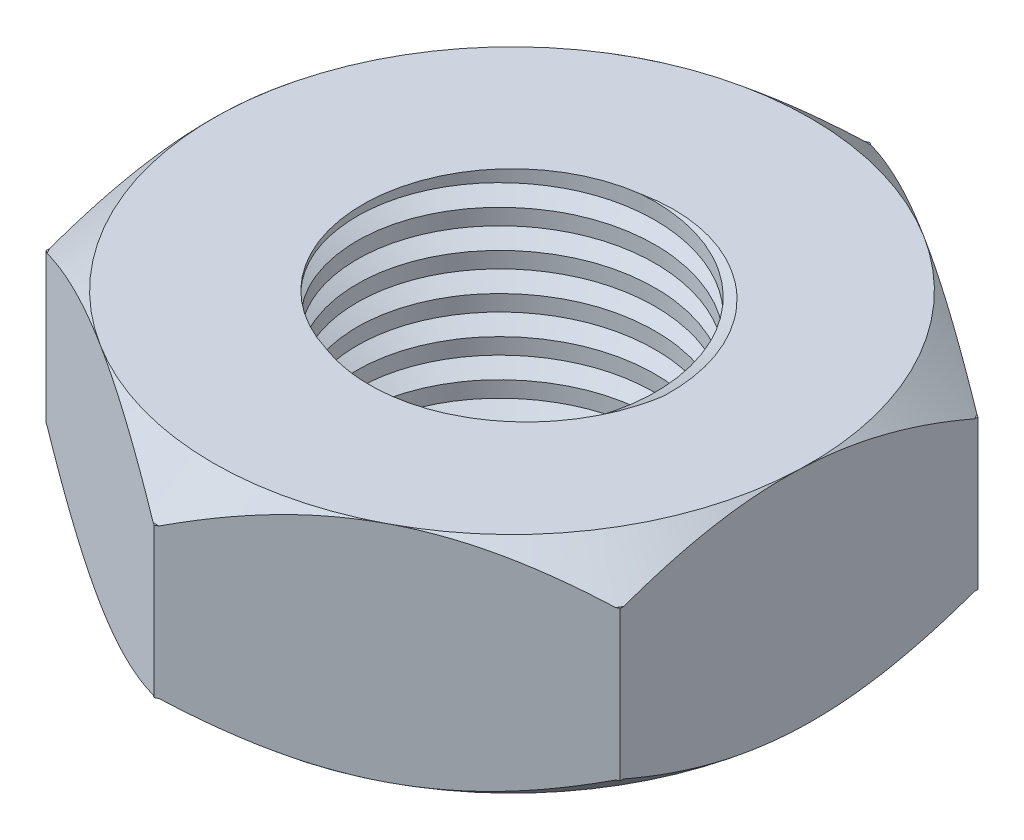
from build123d import *

# Parameters (mm, degrees)
SKETCH1_R           = 1
BOSS_EXTRUDE2_DEPTH = 1.5
SKETCH3_OUTSIDE_W   = 7.948
SKETCH3_OUTSIDE_H   = 8.48
SKETCH3_OUTSIDE_R   = 2
CUT_EXTRUDE2_DEPTH  = 0.25
CUT_EXTRUDE2_DRAFT  = -50
SKETCH4_OUTSIDE_W   = 7.948
SKETCH4_OUTSIDE_H   = 8.48
SKETCH4_OUTSIDE_R   = 2
CUT_EXTRUDE3_DEPTH  = 0.25
CUT_EXTRUDE3_DRAFT  = -50
CUT_SWEEP1_PITCH    = 0.25


with BuildPart() as part:
    # Sketch1 → Boss-Extrude2 (new body)
    with BuildSketch(Plane(origin=(0, 0, 0), x_dir=(1, 0, 0), z_dir=(0, 1, 0))):
        Polygon((2.042476162, 1.077786834), (0.087847303, 2.30772966), (-1.954628859, 1.229942826), (-2.042476162, -1.077786834), (-0.087847303, -2.30772966), (1.954628859, -1.229942826), align=None)
        with Locations(Location((0, 0, 0), (0, 0, 270))):
            Circle(SKETCH1_R, mode=Mode.SUBTRACT)
    extrude(amount=BOSS_EXTRUDE2_DEPTH)


with BuildPart() as cut_extrude2_tool:
    # Sketch3 outside → Cut-Extrude2 (with draft: the straight prism first)
    with BuildSketch(Plane(origin=(0, 1.5, 0), x_dir=(1, 0, 0), z_dir=(0, 1, 0))):
        Rectangle(SKETCH3_OUTSIDE_W, SKETCH3_OUTSIDE_H)
        Circle(SKETCH3_OUTSIDE_R, mode=Mode.SUBTRACT)
    extrude(amount=-CUT_EXTRUDE2_DEPTH)
    # Cut-Extrude2: the draft: its side faces are tilted about the plane it starts from
    cut_extrude2_sides = [cut_extrude2_tool.faces().sort_by_distance(p)[0] for p in [
        (0, 1.375, 4.24),
        (3.974, 1.375, 0),
        (0, 1.375, -4.24),
        (-3.974, 1.375, 0),
        (-2, 1.375, 0),
    ]]
    draft(cut_extrude2_sides, Plane(origin=(0, 1.5, 0), x_dir=(1, 0, 0), z_dir=(0, 1, 0)), CUT_EXTRUDE2_DRAFT)


with BuildPart() as part_1:
    add(part.part)

    # Cut-Extrude2: cut by cut_extrude2_tool
    add(cut_extrude2_tool.part, mode=Mode.SUBTRACT)


with BuildPart() as cut_extrude3_tool:
    # Sketch4 outside → Cut-Extrude3 (with draft: the straight prism first)
    with BuildSketch(Plane.XZ):
        Rectangle(SKETCH4_OUTSIDE_W, SKETCH4_OUTSIDE_H)
        Circle(SKETCH4_OUTSIDE_R, mode=Mode.SUBTRACT)
    extrude(amount=-CUT_EXTRUDE3_DEPTH)
    # Cut-Extrude3: the draft: its side faces are tilted about the plane it starts from
    cut_extrude3_sides = [cut_extrude3_tool.faces().sort_by_distance(p)[0] for p in [
        (0, 0.125, -4.24),
        (3.974, 0.125, 0),
        (0, 0.125, 4.24),
        (-3.974, 0.125, 0),
        (-2, 0.125, 0),
    ]]
    draft(cut_extrude3_sides, Plane.XZ, CUT_EXTRUDE3_DRAFT)


with BuildPart() as part_2:
    add(part_1.part)

    # Cut-Extrude3: cut by cut_extrude3_tool
    add(cut_extrude3_tool.part, mode=Mode.SUBTRACT)

    # Cut-Sweep1: arcs per turn and ends read off the stored shape
    # Cut-Sweep1: the profile of Sketch6 screwed along a right-hand helix through 9 turns, 6 arcs to a turn; built about Z, then put on its axis
    cut_sweep1_z = Axis((0, 0, 0), (0, 0, 1))
    cut_sweep1_corners = [(1.123538971, 0, -0.253292084), (0.933013382, 0, -0.363292084), (0.933013382, 0, -0.143292084)]
    with BuildLine(mode=Mode.PRIVATE) as cut_sweep1_profile:
        Line(cut_sweep1_corners[0], cut_sweep1_corners[1])
        Line(cut_sweep1_corners[1], cut_sweep1_corners[2])
        Line(cut_sweep1_corners[2], cut_sweep1_corners[0])
    cut_sweep1_cap = Face(cut_sweep1_profile.wire())
    cut_sweep1_turn_angles = [0, 30, 60, 90, 120, 150, 180, 210, 240, 270, 300, 330, 360]
    cut_sweep1_turn_weights = [1, 0.8660254037844387, 1, 0.8660254037844387, 1, 0.8660254037844387, 1, 0.8660254037844387, 1, 0.8660254037844387, 1, 0.8660254037844387, 1]
    cut_sweep1_turn_rails = [Edge.make_bspline([Vector(p[0], p[1], 0).rotate(cut_sweep1_z, cut_sweep1_turn_angles[k]) / cut_sweep1_turn_weights[k] + Vector(0, 0, p[2] + CUT_SWEEP1_PITCH * cut_sweep1_turn_angles[k] / 360) for k in range(13)], [0, 0, 0, 1, 1, 2, 2, 3, 3, 4, 4, 5, 5, 6, 6, 6], 2, cut_sweep1_turn_weights) for p in cut_sweep1_corners]
    cut_sweep1_turn_sides = [Face.make_surface_from_curves(cut_sweep1_turn_rails[p[0]], cut_sweep1_turn_rails[p[1]]) for p in [(0, 1), (1, 2), (2, 0)]]
    cut_sweep1 = Plane(origin=(0, 1.5, 0), x_dir=(1, 0, 0), z_dir=(0, -1, 0)) * Solid(Shell([*[p.moved(Location((0, 0, CUT_SWEEP1_PITCH * i))) for i in range(9) for p in cut_sweep1_turn_sides], cut_sweep1_cap, cut_sweep1_cap.rotate(cut_sweep1_z, 3240).moved(Location((0, 0, CUT_SWEEP1_PITCH * 3240 / 360)))]))
    add(cut_sweep1, mode=Mode.SUBTRACT)


solid = part_2.part
